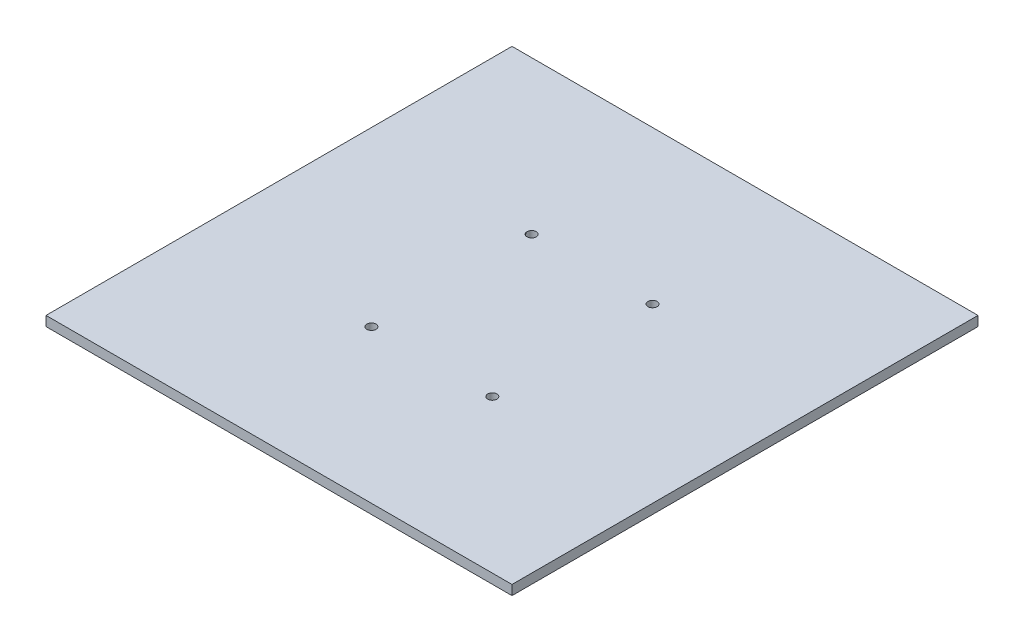
from build123d import *

# Parameters (mm, degrees)
SKETCH1_W           = 152.4
SKETCH1_H           = 152.4
BOSS_EXTRUDE1_DEPTH = 3.175
SKETCH2_R           = 1.5
CUT_EXTRUDE1_DEPTH  = 108.809835474


with BuildPart() as part:
    # Sketch1 → Boss-Extrude1 (new body)
    with BuildSketch(Plane(origin=(0, 0, 0), x_dir=(1, 0, 0), z_dir=(0, 1, 0))):
        Rectangle(SKETCH1_W, SKETCH1_H)
    extrude(amount=BOSS_EXTRUDE1_DEPTH)

    # Sketch2 → Cut-Extrude1 (cut, through all)
    with BuildSketch(Plane(origin=(0, 3.175, 0), x_dir=(1, 0, 0), z_dir=(0, 1, 0))):
        with Locations((19.771067812, -26.19375)):
            Circle(SKETCH2_R)
        with Locations((19.771067812, 26.19375)):
            Circle(SKETCH2_R)
        with Locations((-19.771067812, -26.19375)):
            Circle(SKETCH2_R)
        with Locations((-19.771067812, 26.19375)):
            Circle(SKETCH2_R)
    extrude(amount=-CUT_EXTRUDE1_DEPTH, mode=Mode.SUBTRACT)


solid = part.part
